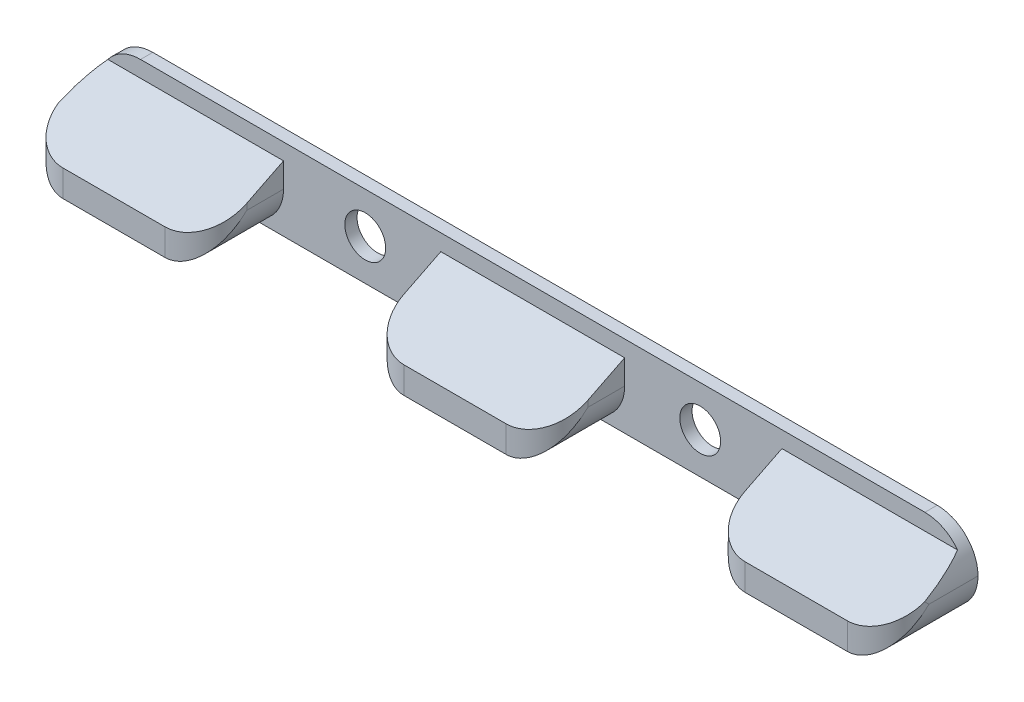
from build123d import *

# Parameters (mm, degrees)
SKETCH1_R           = 5
BOSS_EXTRUDE1_DEPTH = 3
BOSS_EXTRUDE2_DEPTH = 6
CHAMFER1_START      = -106
CHAMFER1_DEPTH      = 45
CHAMFER1_START_2    = -22.5
CHAMFER1_2_DEPTH    = 45
CHAMFER1_START_3    = 61
CHAMFER1_3_DEPTH    = 45
CHAMFER1_START_4    = -4
CHAMFER1_4_DEPTH    = 9.159204648
CHAMFER1_START_5    = 3
CHAMFER1_5_DEPTH    = 10
FILLET1_R           = 10


with BuildPart() as part:
    # Sketch1 → Boss-Extrude1 (new body)
    with BuildSketch(Plane.XY):
        with BuildLine():
            Line((-106, -10), (106, -10))
            Line((106, -10), (106, 0))
            ThreePointArc((106, 0), (103.071067812, 7.071067812), (96, 10))
            Line((96, 10), (-96, 10))
            ThreePointArc((-96, 10), (-103.071067812, 7.071067812), (-106, 0))
            Line((-106, 0), (-106, -10))
        make_face()
        with Locations((-41, 0)):
            Circle(SKETCH1_R, mode=Mode.SUBTRACT)
        with Locations((41, 0)):
            Circle(SKETCH1_R, mode=Mode.SUBTRACT)
    extrude(amount=BOSS_EXTRUDE1_DEPTH)

    # Sketch2 → Boss-Extrude2 (add)
    with BuildSketch(Plane.XZ.offset(10)):
        with BuildLine():
            Line((-106, 0), (-61, 0))
            Line((-61, 0), (-61, 12))
            ThreePointArc((-61, 12), (-63.928932188, 19.071067812), (-71, 22))
            Line((-71, 22), (-96, 22))
            ThreePointArc((-96, 22), (-103.071067812, 19.071067812), (-106, 12))
            Line((-106, 12), (-106, 0))
        make_face()
        with BuildLine():
            Line((106, 0), (61, 0))
            Line((61, 0), (61, 12))
            ThreePointArc((61, 12), (63.928932188, 19.071067812), (71, 22))
            Line((71, 22), (96, 22))
            ThreePointArc((96, 22), (103.071067812, 19.071067812), (106, 12))
            Line((106, 12), (106, 0))
        make_face()
        with BuildLine():
            Line((-22.5, 0), (22.5, 0))
            Line((22.5, 0), (22.5, 12))
            ThreePointArc((22.5, 12), (19.571067812, 19.071067812), (12.5, 22))
            Line((12.5, 22), (-12.5, 22))
            ThreePointArc((-12.5, 22), (-19.571067812, 19.071067812), (-22.5, 12))
            Line((-22.5, 12), (-22.5, 0))
        make_face()
    extrude(amount=-BOSS_EXTRUDE2_DEPTH)

    # Chamfer1: read off the stored shape, not the designer's step
    # Chamfer1 outline → Chamfer1 (add)
    with BuildSketch(Plane.YZ.offset(CHAMFER1_START)):
        Polygon((6, 3), (-3.5, 22), (-4, 22), (-4, 3), align=None)
    extrude(amount=CHAMFER1_DEPTH)

    # Chamfer1 2 outline → Chamfer1 2 (add)
    with BuildSketch(Plane.YZ.offset(CHAMFER1_START_2)):
        Polygon((6, 3), (-3.5, 22), (-4, 22), (-4, 3), align=None)
    extrude(amount=CHAMFER1_2_DEPTH)

    # Chamfer1 3 outline → Chamfer1 3 (add)
    with BuildSketch(Plane.YZ.offset(CHAMFER1_START_3)):
        Polygon((6, 3), (-3.5, 22), (-4, 22), (-4, 3), align=None)
    extrude(amount=CHAMFER1_3_DEPTH)

    # Chamfer1 4 outline → Chamfer1 4 (cut)
    with BuildSketch(Plane(origin=(0, 0, 0), x_dir=(1, 0, 0), z_dir=(0, 1, 0)).offset(CHAMFER1_START_4)):
        with BuildLine():
            Line((-106, -22), (-96, -22))
            ThreePointArc((-96, -22), (-103.071067812, -19.071067812), (-106, -12))
            Line((-106, -12), (-106, -22))
        make_face()
        with BuildLine():
            ThreePointArc((-61, -12), (-63.928932188, -19.071067812), (-71, -22))
            Line((-71, -22), (-61, -22))
            Line((-61, -22), (-61, -12))
        make_face()
        with BuildLine():
            Line((61, -22), (71, -22))
            ThreePointArc((71, -22), (63.928932188, -19.071067812), (61, -12))
            Line((61, -12), (61, -22))
        make_face()
        with BuildLine():
            ThreePointArc((106, -12), (103.071067812, -19.071067812), (96, -22))
            Line((96, -22), (106, -22))
            Line((106, -22), (106, -12))
        make_face()
        with BuildLine():
            Line((-22.5, -22), (-12.5, -22))
            ThreePointArc((-12.5, -22), (-19.571067812, -19.071067812), (-22.5, -12))
            Line((-22.5, -12), (-22.5, -22))
        make_face()
        with BuildLine():
            ThreePointArc((22.5, -12), (19.571067812, -19.071067812), (12.5, -22))
            Line((12.5, -22), (22.5, -22))
            Line((22.5, -22), (22.5, -12))
        make_face()
    extrude(amount=CHAMFER1_4_DEPTH, mode=Mode.SUBTRACT)

    # Chamfer1 5 outline → Chamfer1 5 (cut)
    with BuildSketch(Plane.XY.offset(CHAMFER1_START_5)):
        with BuildLine():
            Line((106, 7), (103.141428429, 7))
            ThreePointArc((103.141428429, 7), (105.257815193, 3.780589618), (106, 0))
            Line((106, 0), (106, 7))
        make_face()
        with BuildLine():
            ThreePointArc((-106, 0), (-105.257815193, 3.780589618), (-103.141428429, 7))
            Line((-103.141428429, 7), (-106, 7))
            Line((-106, 7), (-106, 0))
        make_face()
    extrude(amount=CHAMFER1_5_DEPTH, mode=Mode.SUBTRACT)

    # Fillet1
    # the kernel refuses this fillet: 10 mm, written as the material it takes off along each edge
    with BuildSketch(Plane(origin=(-106, -10, -25), x_dir=(1, 0, 0), z_dir=(0, 0, 1))) as fillet1_piece_1:
        with BuildLine():
            CenterArc((FILLET1_R, FILLET1_R), FILLET1_R, 180, 90)
            Line((0, FILLET1_R), (0, 0))
            Line((0, 0), (FILLET1_R, 0))
        make_face()
    extrude(amount=62, mode=Mode.SUBTRACT)
    with BuildSketch(Plane(origin=(-61, -10, 3), x_dir=(-1, 0, 0), z_dir=(0, 0, 1)), Plane(origin=(61, -10, 3), x_dir=(0, 1, 0), z_dir=(0, 0, 1)), Plane(origin=(-22.5, -10, 37), x_dir=(1, 0, 0), z_dir=(0, 0, -1)), Plane(origin=(22.5, -10, 3), x_dir=(-1, 0, 0), z_dir=(0, 0, 1))) as fillet1_piece_2:
        with BuildLine():
            CenterArc((FILLET1_R, -FILLET1_R), FILLET1_R, 90, 90)
            Line((0, -FILLET1_R), (0, 0))
            Line((0, 0), (FILLET1_R, 0))
        make_face()
    extrude(amount=34, mode=Mode.SUBTRACT)
    with BuildSketch(Plane(origin=(106, -10, 37), x_dir=(0, 1, 0), z_dir=(0, 0, -1))) as fillet1_piece_3:
        with BuildLine():
            CenterArc((FILLET1_R, -FILLET1_R), FILLET1_R, 90, 90)
            Line((0, -FILLET1_R), (0, 0))
            Line((0, 0), (FILLET1_R, 0))
        make_face()
    extrude(amount=62, mode=Mode.SUBTRACT)


solid = part.part
